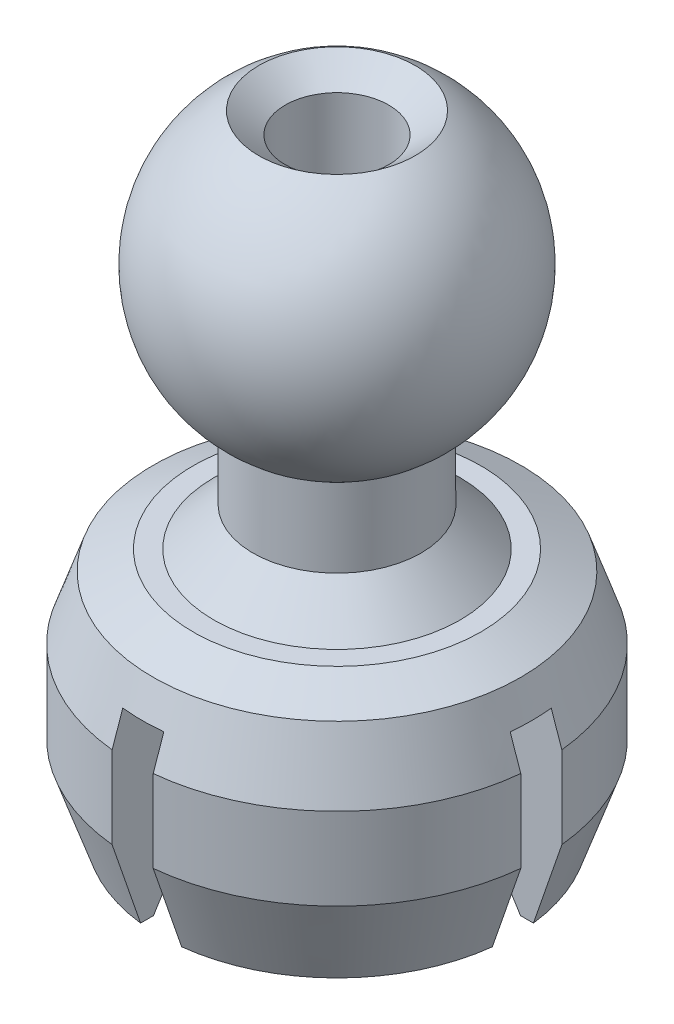
from build123d import *

# Parameters (mm, degrees)
FASE1_SIZE                      = 2
FASE2_SIZE                      = 4
FASE2_SIZE2                     = 1.377310453
FASE3_SIZE                      = 4
FASE3_SIZE2                     = 1.377310453
SCHNITT_LINEAR_AUSTRAGEN1_DEPTH = 9.5
FASE4_SIZE                      = 1
FASE4_SIZE2                     = 1.613032213
FASE5_SIZE                      = 1.623645291


with BuildPart() as part:
    # Skizze1 → Rotation1 (revolve)
    with BuildSketch(Plane.XY, mode=Mode.PRIVATE) as rotation1_sk:
        with BuildLine():
            Line((-2.51871264, 34.081541744), (-2.51871264, 15.53217569))
            Line((-2.51871264, 15.53217569), (-5.248906592, 12.857142857))
            ThreePointArc((-5.248906592, 12.857142857), (-7.478321416, 8.069832253), (-6, 3))
            Line((-6, 3), (-10, 3))
            Line((-10, 3), (-10, 15))
            Line((-10, 15), (-6, 15))
            Line((-6, 15), (-4.093652292, 16.867831662))
            Line((-4.093652292, 16.867831662), (-4.093652292, 20.696496392))
            ThreePointArc((-4.093652292, 20.696496392), (-7.464630082, 27.878319169), (-2.51871264, 34.081541744))
        make_face()
    revolve(rotation1_sk.sketch.rotate(Axis((0, 15, 0), (0, 1, 0)), 180), axis=Axis((0, 15, 0), (0, 1, 0)))

    # Fase1
    # the kernel refuses this chamfer: 2, 1.818354592 mm, written as the material it takes off along each edge
    with BuildSketch(Plane(origin=(0, 3, 0), x_dir=(1, 0, 0), z_dir=(0, 0, 1))) as fase1_piece_1:
        with BuildLine():
            Line((6.949872666, 1.680555032), (6 + FASE1_SIZE, 0))
            Line((6 + FASE1_SIZE, 0), (6, 0))
            ThreePointArc((6, 0), (6.538732617, 0.826449161), (6.949872666, 1.680555032))
        make_face()
    revolve(axis=Axis((0, 3, 0), (0, 1, 0)), mode=Mode.SUBTRACT)

    # Fase2
    fase2_edges = [part.edges().sort_by_distance(p)[0] for p in [
        (-10, 3, 0),
    ]]
    fase2_side = [part.faces().sort_by_distance(p)[0] for p in [
        (-10, 9, 0),
    ]]
    chamfer(fase2_edges, length=FASE2_SIZE, length2=FASE2_SIZE2, reference=fase2_side[0])

    # Fase3
    fase3_edges = [part.edges().sort_by_distance(p)[0] for p in [
        (-10, 15, 0),
    ]]
    fase3_side = [part.faces().sort_by_distance(p)[0] for p in [
        (-10, 11, 0),
    ]]
    chamfer(fase3_edges, length=FASE3_SIZE, length2=FASE3_SIZE2, reference=fase3_side[0])

    # Skizze2 → Schnitt-Linear austragen1 (cut)
    with BuildSketch(Plane.XZ.offset(-3)):
        Polygon((0, 10.698773164), (1, 10.698773164), (1, 1), (12.923434457, 1), (12.923434457, 0), (12.923434457, -1), (1, -1), (1, -10.815383619), (0, -10.815383619), (-1, -10.815383619), (-1, -1), (-10.582773881, -1), (-10.582773881, 0), (-10.582773881, 1), (-1, 1), (-1, 10.698773164), align=None)
    extrude(amount=-SCHNITT_LINEAR_AUSTRAGEN1_DEPTH, mode=Mode.SUBTRACT)

    # Fase4
    fase4_edges = [part.edges().sort_by_distance(p)[0] for p in [
        (-8.622689547, 15, 0),
    ]]
    fase4_side = [part.faces().sort_by_distance(p)[0] for p in [
        (-9.311344773, 13, 0),
    ]]
    chamfer(fase4_edges, length=FASE4_SIZE, length2=FASE4_SIZE2, reference=fase4_side[0])

    # Fase5
    # the kernel refuses this chamfer: 1.623645291, 1.5 mm, written as the material it takes off along each edge
    with BuildSketch(Plane(origin=(0, 34.081541744, 0), x_dir=(1, 0, 0), z_dir=(0, 0, 1))) as fase5_piece_1:
        with BuildLine():
            Line((2.51871264, -FASE5_SIZE), (3.807658871, -0.601273173))
            ThreePointArc((3.807658871, -0.601273173), (3.190605907, -0.276236403), (2.51871264, 0))
            Line((2.51871264, 0), (2.51871264, -FASE5_SIZE))
        make_face()
    revolve(axis=Axis((0, 34.081541744, 0), (0, 1, 0)), mode=Mode.SUBTRACT)


solid = part.part
